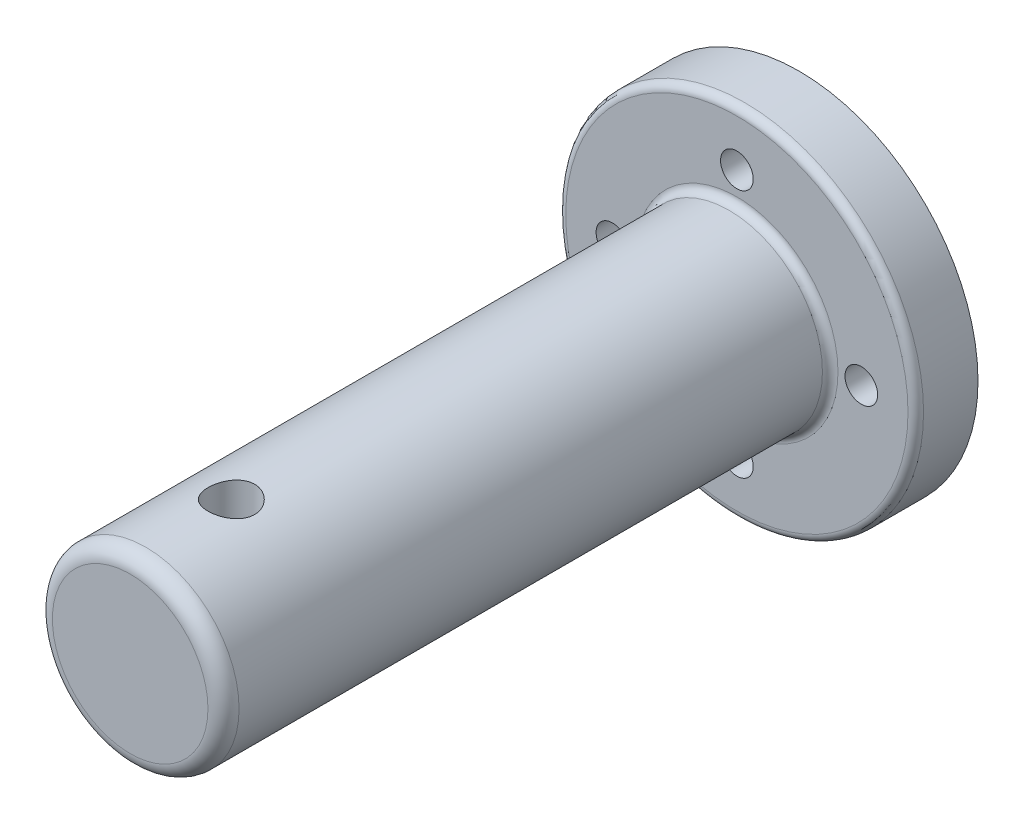
from build123d import *

# Parameters (mm, degrees)
SKETCH1_R               = 11.5
SKETCH1_R_2             = 1.05
BOSS_EXTRUDE1_DEPTH     = 4
SKETCH2_R               = 6
BOSS_EXTRUDE2_DEPTH     = 39
SKETCH3_R               = 4.25
CUT_EXTRUDE1_DEPTH      = 9
FILLET1_R               = 0.5
FILLET2_R               = 1
FILLET4_R               = 1
FILLET5_SIZE            = 7
FILLET5_SIZE_2          = 2.5
CUT_EXTRUDE2_DEPTH      = 46.972818106
CUT_EXTRUDE2_DEPTH_BACK = 46.972818106
SKETCH5_R               = 1.5


with BuildPart() as part:
    # Sketch1 → Boss-Extrude1 (new body)
    with BuildSketch(Plane.XY):
        Circle(SKETCH1_R)
        with Locations((-8, 0)):
            Circle(SKETCH1_R_2, mode=Mode.SUBTRACT)
        with Locations((0, -8)):
            Circle(SKETCH1_R_2, mode=Mode.SUBTRACT)
        with Locations((8, 0)):
            Circle(SKETCH1_R_2, mode=Mode.SUBTRACT)
        with Locations((0, 8)):
            Circle(SKETCH1_R_2, mode=Mode.SUBTRACT)
    extrude(amount=BOSS_EXTRUDE1_DEPTH)

    # Sketch2 → Boss-Extrude2 (add)
    with BuildSketch(Plane.XY.offset(4)):
        Circle(SKETCH2_R)
    extrude(amount=BOSS_EXTRUDE2_DEPTH)

    # Sketch3 → Cut-Extrude1 (cut)
    with BuildSketch(Plane(origin=(0, 0, 0), x_dir=(-1, 0, 0), z_dir=(0, 0, -1))):
        Circle(SKETCH3_R)
    extrude(amount=-CUT_EXTRUDE1_DEPTH, mode=Mode.SUBTRACT)

    # Fillet1
    fillet1_edges = [part.edges().sort_by_distance(p)[0] for p in [
        (-6, 0, 4),
        (-11.5, 0, 4),
    ]]
    fillet(fillet1_edges, radius=FILLET1_R)

    # Fillet2
    fillet2_edges = [part.edges().sort_by_distance(p)[0] for p in [
        (-6, 0, 43),
    ]]
    fillet(fillet2_edges, radius=FILLET2_R)

    # Fillet4
    fillet4_edges = [part.edges().sort_by_distance(p)[0] for p in [
        (4.25, 0, 0),
    ]]
    fillet(fillet4_edges, radius=FILLET4_R)

    # Fillet5
    # an asymmetric fillet: 7, 2.5 mm, written as the material it adds along each edge
    with BuildSketch(Plane(origin=(0, 0, 9), x_dir=(-1, 0, 0), z_dir=(0, -1, 0))) as fillet5_piece_1:
        with BuildLine():
            Bezier((4.25, FILLET5_SIZE), (4.25, 0), (4.25 - FILLET5_SIZE_2, 0), weights=[1, 0.707106781, 1])
            Line((4.25 - FILLET5_SIZE_2, 0), (4.25, 0))
            Line((4.25, 0), (4.25, FILLET5_SIZE))
        make_face()
    revolve(axis=Axis((0, 0, 9), (0, 0, -1)))

    # Sketch5 → Cut-Extrude2 (cut, two sides: drawn at the far end of the back side and taken through both)
    with BuildSketch(Plane(origin=(0, 0, 0), x_dir=(1, 0, 0), z_dir=(0, 1, 0)).offset(-CUT_EXTRUDE2_DEPTH_BACK)):
        with Locations(Location((0, -36.5, 0), (0, 0, 270))):
            Circle(SKETCH5_R)
    extrude(amount=CUT_EXTRUDE2_DEPTH + CUT_EXTRUDE2_DEPTH_BACK, mode=Mode.SUBTRACT)


solid = part.part
